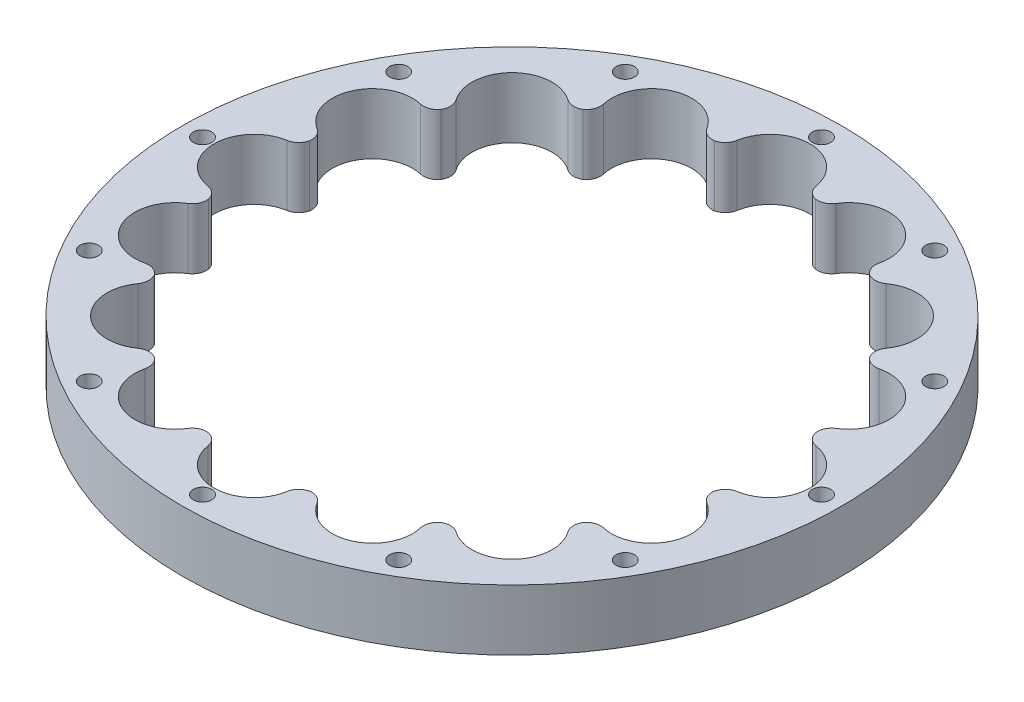
from build123d import *

# Parameters (mm, degrees)
SKETCH1_R           = 57.5
SKETCH1_R_2         = 1.6
BOSS_EXTRUDE1_DEPTH = 10.6
FILLET1_R           = 2.5


with BuildPart() as part:
    # Sketch1 → Boss-Extrude1 (new body)
    with BuildSketch(Plane(origin=(0, 0, 0), x_dir=(1, 0, 0), z_dir=(0, 1, 0))):
        with Locations(Location((0, 0, 0), (0, 0, 270))):
            Circle(SKETCH1_R)
        with Locations(Location((-27, -46.765371804, 0), (0, 0, 270))):
            Circle(SKETCH1_R_2, mode=Mode.SUBTRACT)
        with Locations(Location((-46.765371804, -27, 0), (0, 0, 270))):
            Circle(SKETCH1_R_2, mode=Mode.SUBTRACT)
        with Locations(Location((-54, 0, 0), (0, 0, 270))):
            Circle(SKETCH1_R_2, mode=Mode.SUBTRACT)
        with Locations(Location((0, -54, 0), (0, 0, 270))):
            Circle(SKETCH1_R_2, mode=Mode.SUBTRACT)
        with Locations(Location((27, -46.765371804, 0), (0, 0, 270))):
            Circle(SKETCH1_R_2, mode=Mode.SUBTRACT)
        with BuildLine():
            ThreePointArc((43.742247125, 10.564838686), (44.135337618, 8.779064491), (44.455555556, 6.978795043))
            ThreePointArc((44.455555556, 6.978795043), (49.753361384, 5.138633627), (52, 0))
            ThreePointArc((52, 0), (49.753361384, -5.138633627), (44.455555556, -6.978795043))
            ThreePointArc((44.455555556, -6.978795043), (44.135337618, -8.779064491), (43.742247125, -10.564838686))
            ThreePointArc((43.742247125, -10.564838686), (47.23910353, -13.108193036), (48.574578963, -17.220754456))
            ThreePointArc((48.574578963, -17.220754456), (45.234108152, -23.187985482), (38.400908644, -23.459970489))
            ThreePointArc((38.400908644, -23.459970489), (37.416132554, -25.000660486), (36.369578094, -26.500071496))
            ThreePointArc((36.369578094, -26.500071496), (38.177808401, -28.89135937), (38.819805153, -31.819805153))
            ThreePointArc((38.819805153, -31.819805153), (34.244868492, -38.386316236), (26.500071496, -36.369578094))
            ThreePointArc((26.500071496, -36.369578094), (25.000660486, -37.416132554), (23.459970489, -38.400908644))
            ThreePointArc((23.459970489, -38.400908644), (24.027901885, -39.942787345), (24.220754456, -41.574578963))
            ThreePointArc((24.220754456, -41.574578963), (18.318158122, -48.488022764), (10.564838686, -43.742247125))
            ThreePointArc((10.564838686, -43.742247125), (8.779064491, -44.135337618), (6.978795043, -44.455555556))
            ThreePointArc((6.978795043, -44.455555556), (6.994696752, -44.727571384), (7, -45))
            ThreePointArc((7, -45), (-0.272428616, -51.994696752), (-6.978795043, -44.455555556))
            ThreePointArc((-6.978795043, -44.455555556), (-8.779064491, -44.135337618), (-10.564838686, -43.742247125))
            ThreePointArc((-10.564838686, -43.742247125), (-19.899538483, -48.041735691), (-23.459970489, -38.400908644))
            ThreePointArc((-23.459970489, -38.400908644), (-25.000660486, -37.416132554), (-26.500071496, -36.369578094))
            ThreePointArc((-26.500071496, -36.369578094), (-36.769552622, -36.769552622), (-36.369578094, -26.500071496))
            ThreePointArc((-36.369578094, -26.500071496), (-37.416132554, -25.000660486), (-38.400908644, -23.459970489))
            ThreePointArc((-38.400908644, -23.459970489), (-48.041735691, -19.899538483), (-43.742247125, -10.564838686))
            ThreePointArc((-43.742247125, -10.564838686), (-44.135337618, -8.779064491), (-44.455555556, -6.978795043))
            ThreePointArc((-44.455555556, -6.978795043), (-52, 0), (-44.455555556, 6.978795043))
            ThreePointArc((-44.455555556, 6.978795043), (-44.135337618, 8.779064491), (-43.742247125, 10.564838686))
            ThreePointArc((-43.742247125, 10.564838686), (-48.041735691, 19.899538483), (-38.400908644, 23.459970489))
            ThreePointArc((-38.400908644, 23.459970489), (-37.416132554, 25.000660486), (-36.369578094, 26.500071496))
            ThreePointArc((-36.369578094, 26.500071496), (-36.769552622, 36.769552622), (-26.500071496, 36.369578094))
            ThreePointArc((-26.500071496, 36.369578094), (-25.000660486, 37.416132554), (-23.459970489, 38.400908644))
            ThreePointArc((-23.459970489, 38.400908644), (-19.899538483, 48.041735691), (-10.564838686, 43.742247125))
            ThreePointArc((-10.564838686, 43.742247125), (-8.779064491, 44.135337618), (-6.978795043, 44.455555556))
            ThreePointArc((-6.978795043, 44.455555556), (-0.272428616, 51.994696752), (7, 45))
            ThreePointArc((7, 45), (6.994696752, 44.727571384), (6.978795043, 44.455555556))
            ThreePointArc((6.978795043, 44.455555556), (8.779064491, 44.135337618), (10.564838686, 43.742247125))
            ThreePointArc((10.564838686, 43.742247125), (18.318158122, 48.488022764), (24.220754456, 41.574578963))
            ThreePointArc((24.220754456, 41.574578963), (24.027901885, 39.942787345), (23.459970489, 38.400908644))
            ThreePointArc((23.459970489, 38.400908644), (25.000660486, 37.416132554), (26.500071496, 36.369578094))
            ThreePointArc((26.500071496, 36.369578094), (34.244868492, 38.386316236), (38.819805153, 31.819805153))
            ThreePointArc((38.819805153, 31.819805153), (38.177808401, 28.89135937), (36.369578094, 26.500071496))
            ThreePointArc((36.369578094, 26.500071496), (37.416132554, 25.000660486), (38.400908644, 23.459970489))
            ThreePointArc((38.400908644, 23.459970489), (45.234108152, 23.187985482), (48.574578963, 17.220754456))
            ThreePointArc((48.574578963, 17.220754456), (47.23910353, 13.108193036), (43.742247125, 10.564838686))
        make_face(mode=Mode.SUBTRACT)
        with Locations(Location((46.765371804, -27, 0), (0, 0, 270))):
            Circle(SKETCH1_R_2, mode=Mode.SUBTRACT)
        with Locations(Location((-46.765371804, 27, 0), (0, 0, 270))):
            Circle(SKETCH1_R_2, mode=Mode.SUBTRACT)
        with Locations(Location((-27, 46.765371804, 0), (0, 0, 270))):
            Circle(SKETCH1_R_2, mode=Mode.SUBTRACT)
        with Locations(Location((54, 0, 0), (0, 0, 270))):
            Circle(SKETCH1_R_2, mode=Mode.SUBTRACT)
        with Locations(Location((46.765371804, 27, 0), (0, 0, 270))):
            Circle(SKETCH1_R_2, mode=Mode.SUBTRACT)
        with Locations(Location((0, 54, 0), (0, 0, 270))):
            Circle(SKETCH1_R_2, mode=Mode.SUBTRACT)
        with Locations(Location((27, 46.765371804, 0), (0, 0, 270))):
            Circle(SKETCH1_R_2, mode=Mode.SUBTRACT)
    extrude(amount=BOSS_EXTRUDE1_DEPTH)

    # Fillet1
    # the kernel refuses this fillet: 2.5 mm, written as the material it takes off along each edge
    with BuildSketch(Plane(origin=(43.742247125, -4.820377086, -10.564838686), x_dir=(0.21389520927514544, 0, 0.9768566115091517), z_dir=(0, 1, 0)), Plane(origin=(44.455555556, -4.820377086, 6.978795043), x_dir=(-0.17621343506931061, 0, 0.9843519824234996), z_dir=(0, 1, 0)), Plane(origin=(38.400908644, -4.820377086, 23.459970489), x_dir=(-0.5394951813032318, 0, 0.841988687186825), z_dir=(0, 1, 0)), Plane(origin=(26.500071496, -4.820377086, 36.369578094), x_dir=(-0.8206436767197667, 0, 0.5714402469723874), z_dir=(0, 1, 0)), Plane(origin=(10.564838686, -4.820377086, 43.742247125), x_dir=(-0.9768566115091482, 0, 0.21389520927516179), z_dir=(0, 1, 0)), Plane(origin=(-6.978795043, -4.820377086, 44.455555556), x_dir=(-0.9843519824235082, 0, -0.1762134350692629), z_dir=(0, 1, 0)), Plane(origin=(-23.459970489, -4.820377086, 38.400908644), x_dir=(-0.8419886871868016, 0, -0.5394951813032682), z_dir=(0, 1, 0)), Plane(origin=(-36.369578094, -4.820377086, 26.500071496), x_dir=(-0.5714402469723492, 0, -0.8206436767197933), z_dir=(0, 1, 0)), Plane(origin=(23.459970489, -4.820377086, -38.400908644), x_dir=(0.8419886871867822, 0, 0.5394951813032985), z_dir=(0, 1, 0)), Plane(origin=(6.978795043, -4.820377086, -44.455555556), x_dir=(0.9843519824234905, 0, 0.1762134350693622), z_dir=(0, 1, 0)), Plane(origin=(-10.564838686, -4.820377086, -43.742247125), x_dir=(0.9768566115091611, 0, -0.21389520927510192), z_dir=(0, 1, 0)), Plane(origin=(-26.500071496, -4.820377086, -36.369578094), x_dir=(0.8206436767197971, 0, -0.5714402469723435), z_dir=(0, 1, 0)), Plane(origin=(-38.400908644, -4.820377086, -23.459970489), x_dir=(0.5394951813033058, 0, -0.8419886871867777), z_dir=(0, 1, 0)), Plane(origin=(-44.455555556, -4.820377086, -6.978795043), x_dir=(0.17621343506938397, 0, -0.9843519824234865), z_dir=(0, 1, 0)), Plane(origin=(-43.742247125, -4.820377086, 10.564838686), x_dir=(-0.21389520927510172, 0, -0.9768566115091614), z_dir=(0, 1, 0))) as fillet1_piece_1:
        with BuildLine():
            CenterArc((1.98171058, 2.499426205), FILLET1_R, 199.641418976, 69.130988159)
            ThreePointArc((-0.372826194, 1.659094972), (-0.135846618, 0.840910614), (0, 0))
            ThreePointArc((0, 0), (0.964075417, 0.010328312), (1.928150834, 0))
        make_face()
    extrude(amount=20.240754172, mode=Mode.SUBTRACT)
    with BuildSketch(Plane(origin=(38.400908644, -4.820377086, -23.459970489), x_dir=(0.9397859916311062, 0, -0.34176350000247), z_dir=(0, 1, 0)), Plane(origin=(26.500071496, -4.820377086, -36.369578094), x_dir=(0.7374618133707781, 0, -0.6753888315776947), z_dir=(0, 1, 0)), Plane(origin=(44.455555556, -4.820377086, -6.978795043), x_dir=(0.9990362718468525, 0, 0.043892226354353435), z_dir=(0, 1, 0)), Plane(origin=(43.742247125, -4.820377086, 10.564838686), x_dir=(0.9061923359602189, 0, 0.42286575913280305), z_dir=(0, 1, 0)), Plane(origin=(36.369578094, -4.820377086, 26.500071496), x_dir=(0.6753888315777279, 0, 0.7374618133707476), z_dir=(0, 1, 0)), Plane(origin=(23.459970489, -4.820377086, 38.400908644), x_dir=(0.3417635000024204, 0, 0.9397859916311243), z_dir=(0, 1, 0)), Plane(origin=(6.978795043, -4.820377086, 44.455555556), x_dir=(-0.043892226354455326, 0, 0.9990362718468481), z_dir=(0, 1, 0)), Plane(origin=(-10.564838686, -4.820377086, 43.742247125), x_dir=(-0.4228657591328737, 0, 0.9061923359601859), z_dir=(0, 1, 0)), Plane(origin=(-26.500071496, -4.820377086, 36.369578094), x_dir=(-0.7374618133709434, 0, 0.6753888315775142), z_dir=(0, 1, 0)), Plane(origin=(10.564838686, -4.820377086, -43.742247125), x_dir=(0.4228657591329353, 0, -0.9061923359601571), z_dir=(0, 1, 0)), Plane(origin=(-6.978795043, -4.820377086, -44.455555556), x_dir=(0.04389222635458482, 0, -0.9990362718468423), z_dir=(0, 1, 0)), Plane(origin=(-23.459970489, -4.820377086, -38.400908644), x_dir=(-0.3417635000022023, 0, -0.9397859916312036), z_dir=(0, 1, 0)), Plane(origin=(-36.369578094, -4.820377086, -26.500071496), x_dir=(-0.6753888315774389, 0, -0.7374618133710125), z_dir=(0, 1, 0)), Plane(origin=(-43.742247125, -4.820377086, -10.564838686), x_dir=(-0.9061923359601008, 0, -0.422865759133056), z_dir=(0, 1, 0)), Plane(origin=(-44.455555556, -4.820377086, 6.978795043), x_dir=(-0.9990362718468366, 0, -0.04389222635471359), z_dir=(0, 1, 0)), Plane(origin=(-38.400908644, -4.820377086, 23.459970489), x_dir=(-0.9397859916312232, 0, 0.3417635000021483), z_dir=(0, 1, 0))) as fillet1_piece_2:
        with BuildLine():
            CenterArc((2.004124414, 2.481490179), FILLET1_R, 193.892520635, 69.130988159)
            ThreePointArc((-0.422745168, 1.881236871), (-0.201295571, 0.942882908), (0, 0))
            ThreePointArc((0, 0), (0.8502346, 0.051827497), (1.700469199, 0))
        make_face()
    extrude(amount=20.240754172, mode=Mode.SUBTRACT)
    with BuildSketch(Plane(origin=(36.369578094, -4.820377086, -26.500071496), x_dir=(0.6753888315776805, 0, -0.7374618133707912), z_dir=(0, 1, 0))) as fillet1_piece_3:
        with BuildLine():
            CenterArc((2.004124414, -2.481490179), FILLET1_R, 96.976491207, 69.130988159)
            ThreePointArc((-0.422745168, -1.881236871), (-0.201295571, -0.942882908), (0, 0))
            ThreePointArc((0, 0), (0.8502346, -0.051827497), (1.700469199, 0))
        make_face()
    extrude(amount=20.240754172, mode=Mode.SUBTRACT)


solid = part.part
